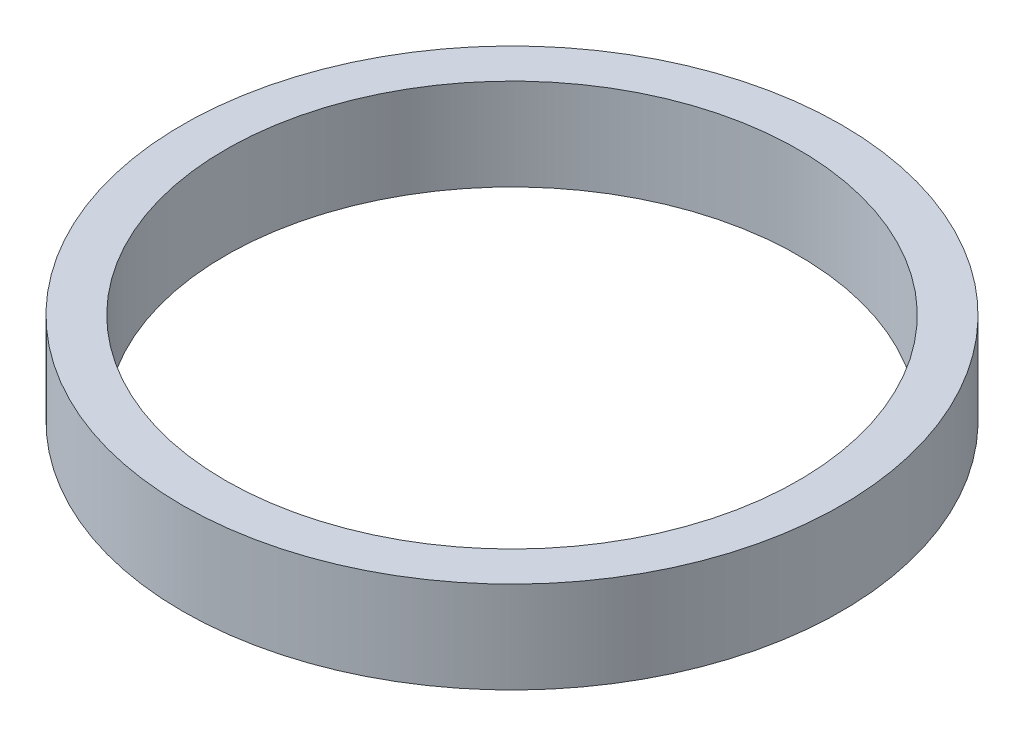
from build123d import *

# Parameters (mm, degrees)
SKETCH1_R           = 57.5
BOSS_EXTRUDE1_DEPTH = 16
SKETCH2_R           = 50
CUT_EXTRUDE1_DEPTH  = 83.876414015


with BuildPart() as part:
    # Sketch1 → Boss-Extrude1 (new body)
    with BuildSketch(Plane(origin=(0, 0, 0), x_dir=(1, 0, 0), z_dir=(0, 1, 0))):
        Circle(SKETCH1_R)
    extrude(amount=BOSS_EXTRUDE1_DEPTH)

    # Sketch2 → Cut-Extrude1 (cut, through all)
    with BuildSketch(Plane(origin=(0, 0, 0), x_dir=(1, 0, 0), z_dir=(0, 1, 0))):
        Circle(SKETCH2_R)
    extrude(amount=CUT_EXTRUDE1_DEPTH, mode=Mode.SUBTRACT)


solid = part.part
